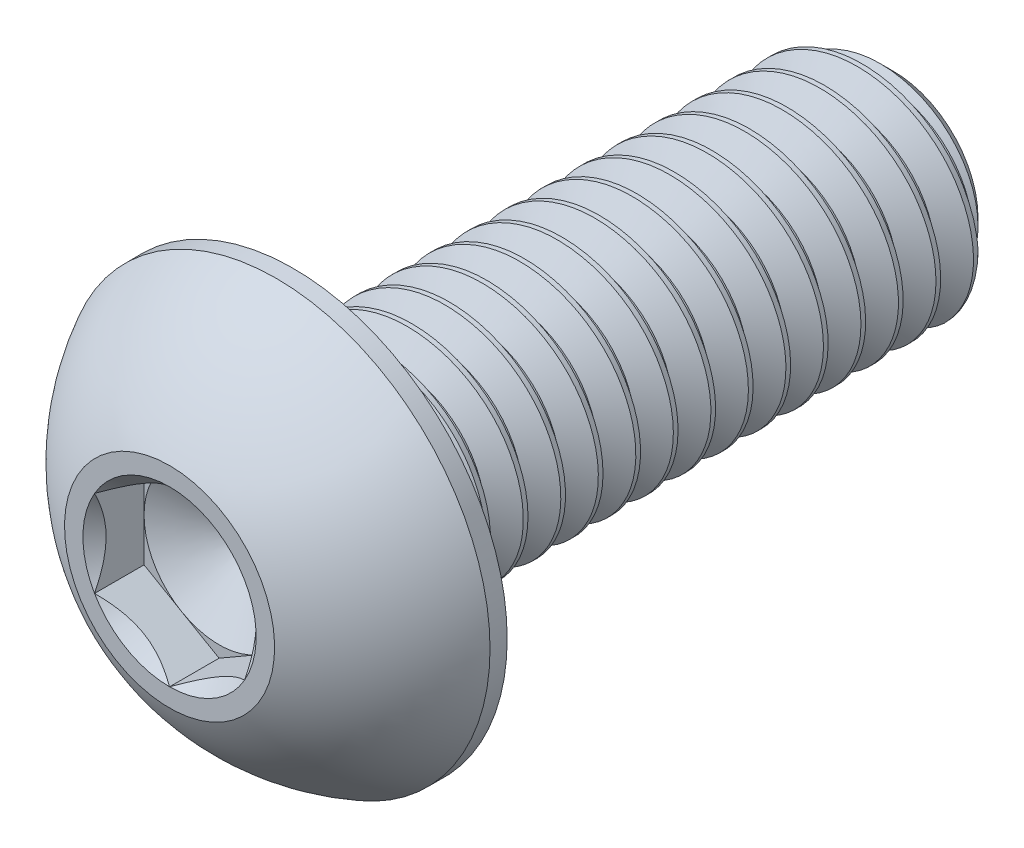
from build123d import *

# Parameters (mm, degrees)
CUT_EXTRUDE1_START = 4.165
CUT_EXTRUDE1_DEPTH = 3.12194083
CUT_SWEEP1_PITCH   = 0.5


with BuildPart() as part:
    # Sketch2 → Revolve1 (revolve)
    with BuildSketch(Plane(origin=(0, 0, 0), x_dir=(0, 0, -1), z_dir=(1, 0, 0)), mode=Mode.PRIVATE) as revolve1_sk:
        with BuildLine():
            Line((-4.825, 1), (-4.825, 1.4))
            ThreePointArc((-4.825, 1.4), (-4.232312095, 2.240700738), (-3.403571429, 2.85))
            Line((-3.403571429, 2.85), (-3.175, 2.85))
            Line((-3.175, 2.85), (-3.175, 1.5))
            Line((-3.175, 1.5), (4.45, 1.5))
            Line((4.45, 1.5), (4.825, 1.125))
            Line((4.825, 1.125), (4.825, 0))
            Line((4.825, 0), (-3.587649731, 0))
            Line((-3.587649731, 0), (-4.165, 1))
            Line((-4.165, 1), (-4.825, 1))
        make_face()
    revolve(revolve1_sk.sketch.rotate(Axis((0, 0, 4.825), (0, 0, -1)), 90), axis=Axis((0, 0, 4.825), (0, 0, -1)))

    # Sketch3 → Cut-Extrude1 (cut, through all)
    with BuildSketch(Plane.XY.offset(CUT_EXTRUDE1_START)):
        Polygon((0, 1.154700538), (-1, 0.577350269), (-1, -0.577350269), (0, -1.154700538), (1, -0.577350269), (1, 0.577350269), align=None)
    extrude(amount=CUT_EXTRUDE1_DEPTH, mode=Mode.SUBTRACT)

    # Cut-Extrude2 cone 1 section (through the dimple's axis) → Cut-Extrude2 (revolve, cut)
    with BuildSketch(Plane(origin=(0, 0, 4.825), x_dir=(0, -1, 0), z_dir=(1, 0, 0))):
        Polygon((0, 0), (1.154700538, 0), (0, 1.154700538), align=None)
    revolve(axis=Axis((0, 0, 4.825), (0, 0, -1)), mode=Mode.SUBTRACT)

    # Cut-Sweep1: the profile of Sketch6 screwed along a right-hand helix of 17 turns, 6 arcs to a turn; built about Z, then put on its axis
    cut_sweep1_z = Axis((0, 0, 0), (0, 0, 1))
    cut_sweep1_corners = [(1.527063294, 0, 0.015625), (1.527063294, 0, -0.453125), (1.175240474, 0, -0.25), (1.175240474, 0, -0.1875)]
    with BuildLine(mode=Mode.PRIVATE) as cut_sweep1_profile:
        Line(cut_sweep1_corners[0], cut_sweep1_corners[1])
        Line(cut_sweep1_corners[1], cut_sweep1_corners[2])
        Line(cut_sweep1_corners[2], cut_sweep1_corners[3])
        Line(cut_sweep1_corners[3], cut_sweep1_corners[0])
    cut_sweep1_cap = Face(cut_sweep1_profile.wire())
    cut_sweep1_turn_angles = [0, 30, 60, 90, 120, 150, 180, 210, 240, 270, 300, 330, 360]
    cut_sweep1_turn_weights = [1, 0.8660254037844387, 1, 0.8660254037844387, 1, 0.8660254037844387, 1, 0.8660254037844387, 1, 0.8660254037844387, 1, 0.8660254037844387, 1]
    cut_sweep1_turn_rails = [Edge.make_bspline([Vector(p[0], p[1], 0).rotate(cut_sweep1_z, cut_sweep1_turn_angles[k]) / cut_sweep1_turn_weights[k] + Vector(0, 0, p[2] + CUT_SWEEP1_PITCH * cut_sweep1_turn_angles[k] / 360) for k in range(13)], [0, 0, 0, 1, 1, 2, 2, 3, 3, 4, 4, 5, 5, 6, 6, 6], 2, cut_sweep1_turn_weights) for p in cut_sweep1_corners]
    cut_sweep1_turn_sides = [Face.make_surface_from_curves(cut_sweep1_turn_rails[p[0]], cut_sweep1_turn_rails[p[1]]) for p in [(0, 1), (1, 2), (2, 3), (3, 0)]]
    cut_sweep1 = Plane(origin=(0, 0, -4.825), x_dir=(0, 1, 0), z_dir=(0, 0, 1)) * Solid(Shell([*[p.moved(Location((0, 0, CUT_SWEEP1_PITCH * i))) for i in range(17) for p in cut_sweep1_turn_sides], cut_sweep1_cap, cut_sweep1_cap.rotate(cut_sweep1_z, 6120).moved(Location((0, 0, CUT_SWEEP1_PITCH * 6120 / 360)))]))
    add(cut_sweep1, mode=Mode.SUBTRACT)


solid = part.part
